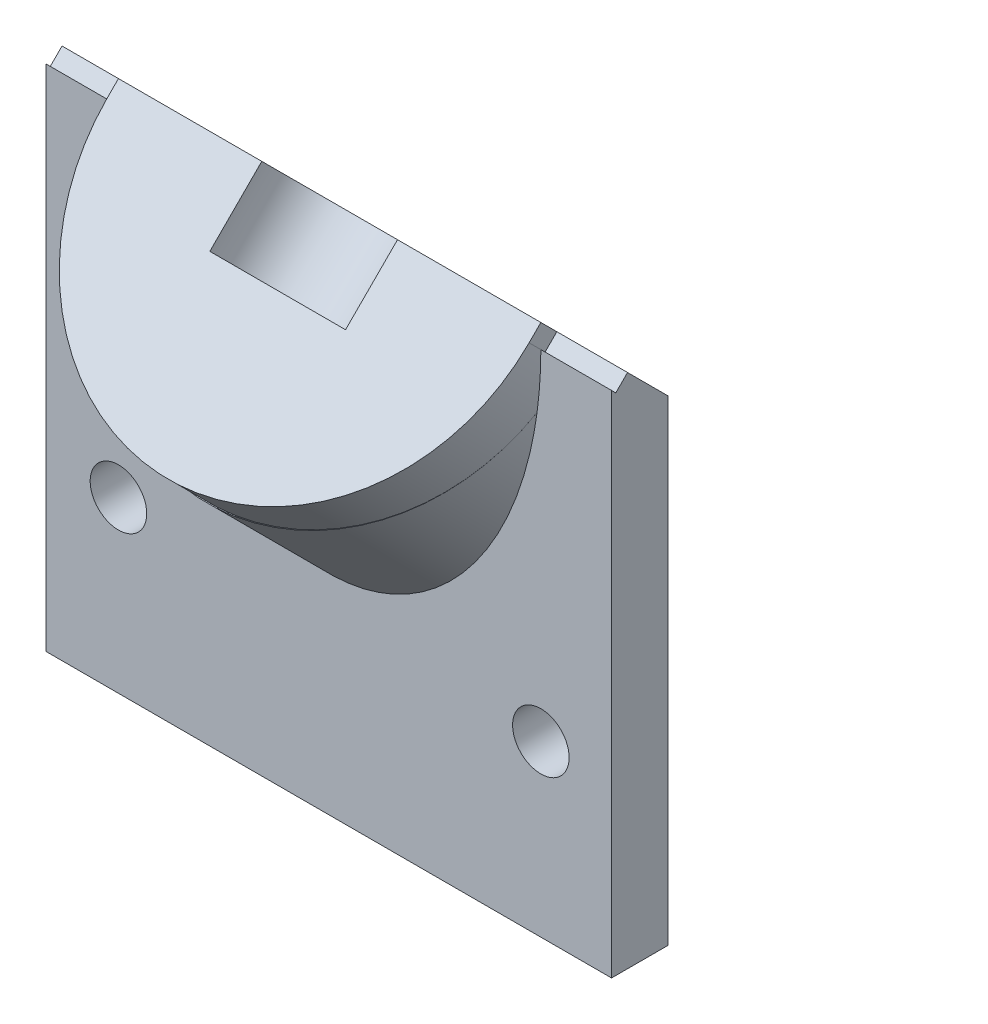
from build123d import *

# Parameters (mm, degrees)
SKETCH1_W                = 50
SKETCH1_H                = 35
BOSS_EXTRUDE1_DEPTH      = 5
BOSS_EXTRUDE2_DEPTH      = 50
BOSS_EXTRUDE3_DEPTH      = 50
BOSS_EXTRUDE3_DEPTH_BACK = 50
SKETCH4_R                = 18.75
CUT_EXTRUDE1_DEPTH       = 100
SKETCH9_W                = 50
SKETCH9_H                = 44.069235532
CUT_EXTRUDE2_DEPTH       = 100
SKETCH10_W               = 50
SKETCH10_H               = 40
CUT_EXTRUDE3_DEPTH       = 100
CUT_EXTRUDE4_DEPTH       = 100
BOSS_EXTRUDE4_DEPTH      = 50
CUT_EXTRUDE5_DEPTH       = 50
SKETCH14_W               = 5
SKETCH14_H               = 5
BOSS_EXTRUDE5_DEPTH      = 50
BOSS_EXTRUDE6_DEPTH      = 5
BOSS_EXTRUDE7_DEPTH      = 50
CUT_EXTRUDE7_DEPTH       = 50
CUT_EXTRUDE8_DEPTH       = 50
BOSS_EXTRUDE8_DEPTH      = 50
SKETCH21_W               = 6.25020151
SKETCH21_H               = 1.47001591
SKETCH21_W_2             = 6.403257487
CUT_EXTRUDE9_DEPTH       = 2
SKETCH22_R               = 6
CUT_EXTRUDE10_DEPTH      = 6.5
SKETCH23_R               = 2.5
CUT_EXTRUDE11_DEPTH      = 6.5


with BuildPart() as part:
    # Sketch1 → Boss-Extrude1 (new body)
    with BuildSketch(Plane.XY):
        Rectangle(SKETCH1_W, SKETCH1_H)
    extrude(amount=BOSS_EXTRUDE1_DEPTH)

    # Sketch3 → Boss-Extrude2 (add)
    with BuildSketch(Plane(origin=(25, 0, 0), x_dir=(0, 0, -1), z_dir=(1, 0, 0))):
        Polygon((-5, 17.5), (0, 17.5), (0, 22.5), align=None)
    extrude(amount=-BOSS_EXTRUDE2_DEPTH)

    # Sketch4 → Boss-Extrude3 (add, two sides: drawn at the far end of the back side and taken through both)
    with BuildSketch(Plane(origin=(0, 11.25, 11.25), x_dir=(1, 0, 0), z_dir=(0, 0.7071067811865476, 0.7071067811865476)).offset(-BOSS_EXTRUDE3_DEPTH_BACK)):
        with Locations((0, 12.374368671)):
            Circle(SKETCH4_R)
    extrude(amount=BOSS_EXTRUDE3_DEPTH + BOSS_EXTRUDE3_DEPTH_BACK)

    # Sketch5 → Cut-Extrude1 (cut)
    with BuildSketch(Plane(origin=(0, 46.605339059, 46.605339059), x_dir=(1, 0, 0), z_dir=(0, 0.7071067811865477, 0.7071067811865475))):
        with BuildLine():
            Line((-18.75, 12.374368671), (18.75, 12.374368671))
            ThreePointArc((18.75, 12.374368671), (0, 31.124368671), (-18.75, 12.374368671))
        make_face()
    extrude(amount=-CUT_EXTRUDE1_DEPTH, mode=Mode.SUBTRACT)

    # Sketch9 → Cut-Extrude2 (cut)
    with BuildSketch(Plane(origin=(0, 11.25, 11.25), x_dir=(1, 0, 0), z_dir=(0, 0.7071067811865476, 0.7071067811865476))):
        with Locations((0, -9.660249095)):
            Rectangle(SKETCH9_W, SKETCH9_H)
    extrude(amount=CUT_EXTRUDE2_DEPTH, mode=Mode.SUBTRACT)

    # Sketch10 → Cut-Extrude3 (cut)
    with BuildSketch(Plane(origin=(0, 0, 0), x_dir=(-1, 0, 0), z_dir=(0, 0, -1))):
        with Locations((0, 2.5)):
            Rectangle(SKETCH10_W, SKETCH10_H)
    extrude(amount=CUT_EXTRUDE3_DEPTH, mode=Mode.SUBTRACT)


with BuildPart() as cut_extrude3_piece_1:
    # of the separate pieces the step leaves, piece 1, a body of its own (cut_extrude3_pieces)
    add(part.part.solids().sort_by_distance((25, -17.5, 0))[0])

    # Sketch12 → Boss-Extrude4 (add)
    with BuildSketch(Plane(origin=(25, 0, 0), x_dir=(0, 0, -1), z_dir=(1, 0, 0))):
        Polygon((-5, 17.5), (0, 17.5), (0, 22.5), align=None)
    extrude(amount=-BOSS_EXTRUDE4_DEPTH)

    # Sketch13 → Cut-Extrude5 (cut)
    with BuildSketch(Plane(origin=(25, 0, 0), x_dir=(0, 0, -1), z_dir=(1, 0, 0))):
        Polygon((0, 17.5), (0, 12.5), (-5, 17.5), (0, 22.5), align=None)
    extrude(amount=-CUT_EXTRUDE5_DEPTH, mode=Mode.SUBTRACT)

    # Sketch14 → Boss-Extrude5 (add)
    with BuildSketch(Plane(origin=(25, 0, 0), x_dir=(0, 0, -1), z_dir=(1, 0, 0))):
        with Locations((-2.5, -20)):
            Rectangle(SKETCH14_W, SKETCH14_H)
    extrude(amount=-BOSS_EXTRUDE5_DEPTH)

    # Sketch15 → Boss-Extrude6 (add)
    with BuildSketch(Plane(origin=(0, 11.25, 11.25), x_dir=(1, 0, 0), z_dir=(0, 0.7071067811865476, 0.7071067811865476))):
        with BuildLine():
            Line((18.74979849, 12.374368641), (-18.596524064, 12.368818855))
            ThreePointArc((-18.596524064, 12.368818855), (0.079412106, -6.301567529), (18.74979849, 12.374368641))
        make_face()
    extrude(amount=BOSS_EXTRUDE6_DEPTH)

    # Sketch16 → Boss-Extrude7 (add)
    with BuildSketch(Plane.ZY.offset(25)):
        Polygon((0, 12.5), (5, 12.5), (5, 22.492151375), (6.039458218, 23.531609594), (0, 29.571067812), (0, 23.531609594), align=None)
    extrude(amount=-BOSS_EXTRUDE7_DEPTH)

    # Sketch18 → Cut-Extrude7 (cut)
    with BuildSketch(Plane(origin=(25, 0, 0), x_dir=(0, 0, -1), z_dir=(1, 0, 0))):
        Polygon((-5, 22.492151375), (-6.039458218, 23.531609594), (-5, 24.571067812), align=None)
    extrude(amount=-CUT_EXTRUDE7_DEPTH, mode=Mode.SUBTRACT)

    # Sketch19 → Cut-Extrude8 (cut)
    with BuildSketch(Plane(origin=(25, 0, 0), x_dir=(0, 0, -1), z_dir=(1, 0, 0))):
        Polygon((0, 19.571067812), (0, 24.571067812), (0, 29.571067812), (-5, 24.571067812), align=None)
    extrude(amount=-CUT_EXTRUDE8_DEPTH, mode=Mode.SUBTRACT)

    # Sketch20 → Boss-Extrude8 (add)
    with BuildSketch(Plane(origin=(25, 0, 0), x_dir=(0, 0, -1), z_dir=(1, 0, 0))):
        Polygon((-5, 22.492151375), (-6.039458218, 23.531609594), (-5, 24.571067812), align=None)
    extrude(amount=-BOSS_EXTRUDE8_DEPTH)

    # Sketch21 → Cut-Extrude9 (cut)
    with BuildSketch(Plane(origin=(0, 14.785533906, 14.785533906), x_dir=(1, 0, 0), z_dir=(0, 0.7071067811865476, 0.7071067811865475))):
        with Locations((21.874899245, 13.10382681)):
            Rectangle(SKETCH21_W, SKETCH21_H)
        with Locations((-21.798371257, 13.10382681)):
            Rectangle(SKETCH21_W_2, SKETCH21_H)
    extrude(amount=-CUT_EXTRUDE9_DEPTH, mode=Mode.SUBTRACT)

    # Sketch22 → Cut-Extrude10 (cut)
    with BuildSketch(Plane(origin=(0, 9.785533906, -9.785533906), x_dir=(1, 0, 0), z_dir=(0, 0.7071067811865476, -0.7071067811865476))):
        with Locations((0.076527988, -20.909902577)):
            Circle(SKETCH22_R)
    extrude(amount=-CUT_EXTRUDE10_DEPTH, mode=Mode.SUBTRACT)

    # Sketch23 → Cut-Extrude11 (cut)
    with BuildSketch(Plane.XY.offset(5)):
        with Locations((-18.596742513, -7.5)):
            Circle(SKETCH23_R)
        with Locations((18.74979849, -7.5)):
            Circle(SKETCH23_R)
    extrude(amount=-CUT_EXTRUDE11_DEPTH, mode=Mode.SUBTRACT)


with BuildPart() as cut_extrude3_piece_2:
    # of the separate pieces the step leaves, piece 2, a body of its own (cut_extrude3_pieces)
    add(part.part.solids().sort_by_distance((-18.5030635, -17.5, -30.710678119))[0])

    # Sketch11 → Cut-Extrude4 (cut)
    with BuildSketch(Plane(origin=(0, -17.5, 0), x_dir=(1, 0, 0), z_dir=(0, 1, 0))):
        Polygon((-18.5030635, 30.710678119), (-17.762278405, 6.480797306), (17.552828989, 7.560493298), (18.502745756, 30.710678119), align=None)
    extrude(amount=-CUT_EXTRUDE4_DEPTH, mode=Mode.SUBTRACT)


solid = Compound([cut_extrude3_piece_1.part, cut_extrude3_piece_2.part])
